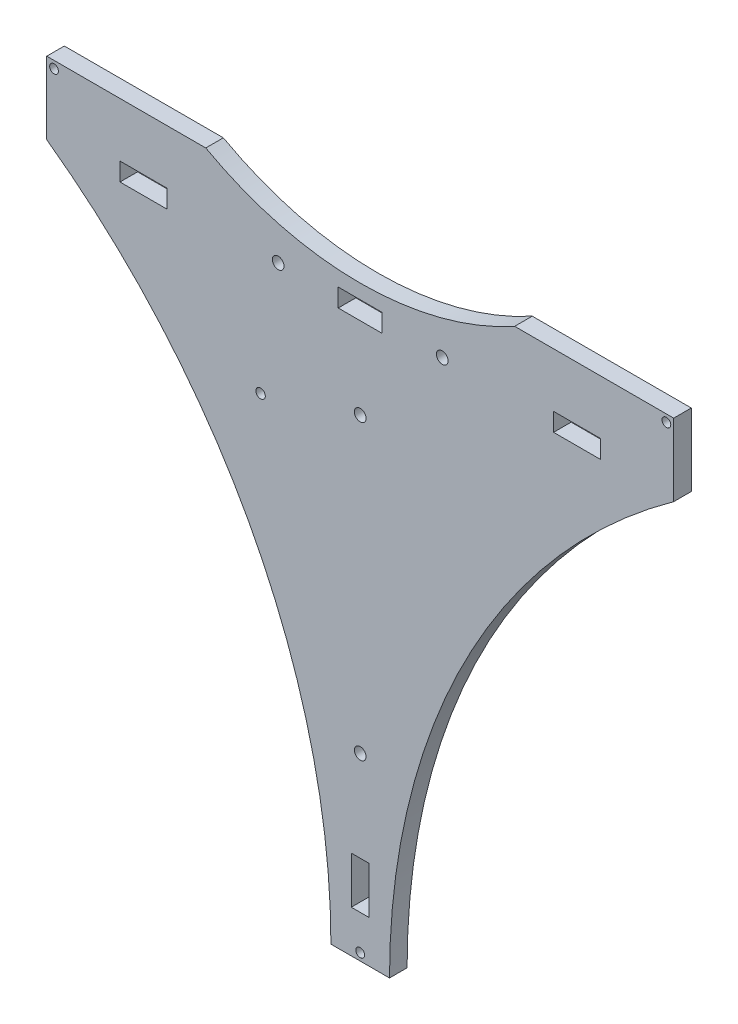
from build123d import *

# Parameters (mm, degrees)
SKETCH1_R           = 1.5
SKETCH1_R_2         = 2
SKETCH1_R_3         = 1.6
SKETCH1_W           = 16
SKETCH1_H           = 6.2
SKETCH1_W_2         = 6.1
SKETCH1_H_2         = 16
SKETCH1_W_3         = 15
BOSS_EXTRUDE1_DEPTH = 6


with BuildPart() as part:
    # Sketch1 → Boss-Extrude1 (new body)
    with BuildSketch(Plane.XY):
        with BuildLine():
            Line((86.201143473, 107), (107, 107))
            Line((107, 107), (107, 82.3))
            ThreePointArc((107, 82.3), (35.661860966, -0.64741423), (10, -107))
            Line((10, -107), (-10, -107))
            ThreePointArc((-10, -107), (-35.661860966, -0.64741423), (-107, 82.3))
            Line((-107, 82.3), (-107, 107))
            Line((-107, 107), (-91.798856527, 107))
            Line((-91.798856527, 107), (-52.717063467, 107))
            ThreePointArc((-52.717063467, 107), (0, 93.4), (52.717063467, 107))
            Line((52.717063467, 107), (86.201143473, 107))
        make_face()
        with Locations((-104.5, 104.5)):
            Circle(SKETCH1_R, mode=Mode.SUBTRACT)
        with Locations((104.5, 104.5)):
            Circle(SKETCH1_R, mode=Mode.SUBTRACT)
        with Locations((-28, 85.4)):
            Circle(SKETCH1_R_2, mode=Mode.SUBTRACT)
        with Locations((-34, 43.8)):
            Circle(SKETCH1_R_3, mode=Mode.SUBTRACT)
        with Locations((0, 54.4)):
            Circle(SKETCH1_R_2, mode=Mode.SUBTRACT)
        with Locations((0, -104.5)):
            Circle(SKETCH1_R, mode=Mode.SUBTRACT)
        with Locations((0, -45.6)):
            Circle(SKETCH1_R_2, mode=Mode.SUBTRACT)
        with Locations((28, 85.4)):
            Circle(SKETCH1_R_2, mode=Mode.SUBTRACT)
        with Locations((-74, 85.4)):
            Rectangle(SKETCH1_W, SKETCH1_H, mode=Mode.SUBTRACT)
        with Locations((74, 85.4)):
            Rectangle(SKETCH1_W, SKETCH1_H, mode=Mode.SUBTRACT)
        with Locations((0, -84.6)):
            Rectangle(SKETCH1_W_2, SKETCH1_H_2, mode=Mode.SUBTRACT)
        with Locations((0, 85.4)):
            Rectangle(SKETCH1_W_3, SKETCH1_H, mode=Mode.SUBTRACT)
    extrude(amount=BOSS_EXTRUDE1_DEPTH)


solid = part.part
